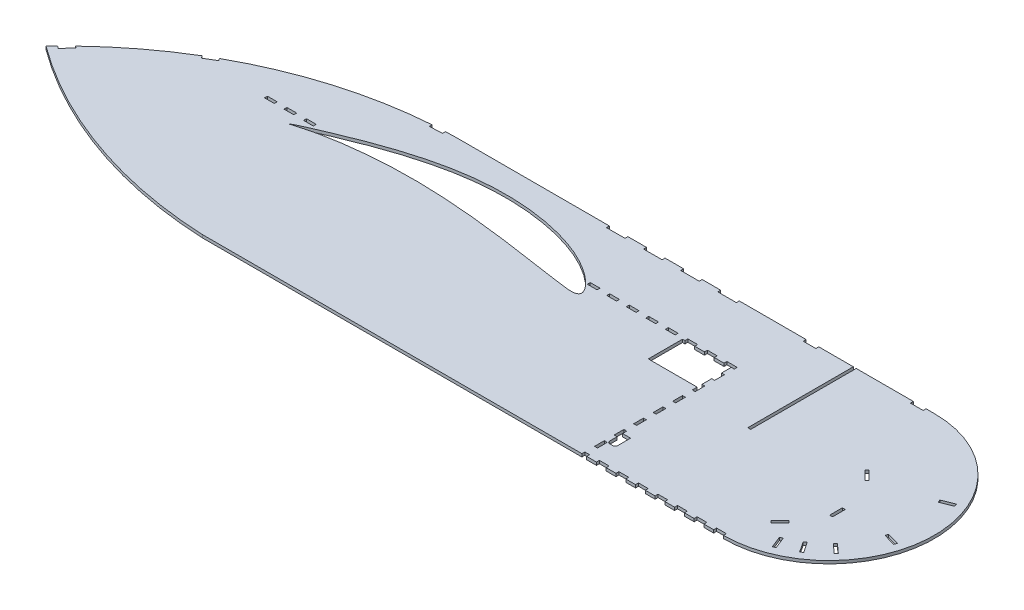
from build123d import *

# Parameters (mm, degrees)
BOSS_EXTRUDE1_DEPTH = 3
SKETCH2_W           = 3
SKETCH2_H           = 13
SKETCH2_W_2         = 13
SKETCH2_H_2         = 3
SKETCH2_W_3         = 19
SKETCH2_W_4         = 10
SKETCH2_H_3         = 10
SKETCH2_W_5         = 4.93
SKETCH2_H_4         = 108
CUT_EXTRUDE1_DEPTH  = 934.342916617


with BuildPart() as part:
    # Sketch1 → Boss-Extrude1 (new body)
    with BuildSketch(Plane(origin=(0, 0, 0), x_dir=(1, 0, 0), z_dir=(0, 1, 0))):
        with BuildLine():
            Line((266.408252791, 0), (800, 0))
            ThreePointArc((800, 0), (908, 108), (800, 216))
            Line((800, 216), (316.294556964, 216))
            ThreePointArc((316.294556964, 216), (154.432198565, 182.326352039), (19.429068043, 86.893169221))
            ThreePointArc((19.429068043, 86.893169221), (136.475600537, 25.133273094), (266.408252791, 0))
        make_face()
    extrude(amount=BOSS_EXTRUDE1_DEPTH)

    # Sketch2 → Cut-Extrude1 (cut, through all)
    with BuildSketch(Plane.XZ):
        Polygon((647.57, -153), (637.57, -153), (637.57, -156), (627.57, -156), (627.57, -153), (617.57, -153), (617.57, -156), (607.57, -156), (607.57, -153), (605.07, -153), (605.07, -118), (655.07, -118), (655.07, -113), (658.07, -113), (658.07, -123), (655.07, -123), (655.07, -133), (658.07, -133), (658.07, -143), (655.07, -143), (655.07, -153), (658.07, -153), (658.07, -156), (647.57, -156), align=None)
        Polygon((823.689305433, -121.232773417), (814.496917278, -130.425161573), (816.618237622, -132.546481916), (825.810625777, -123.354093761), align=None)
        Polygon((833.160643349, -28.105884629), (837.93522035, -16.014424235), (835.144883336, -14.912598773), (830.370306335, -27.004059167), align=None)
        with Locations((837.95655194, -78.816857664)):
            Rectangle(SKETCH2_W, SKETCH2_H)
        with BuildLine():
            Line((658.07, -25.473381029), (658.07, -33))
            Line((658.07, -33), (655.07, -33))
            Line((655.07, -33), (655.07, -43))
            Line((655.07, -43), (658.07, -43))
            Line((658.07, -43), (658.07, -38.673381029))
            Line((658.07, -38.673381029), (666.27, -38.673381029))
            Line((666.27, -38.673381029), (666.27, -25.473381029))
            ThreePointArc((666.27, -25.473381029), (665.537766953, -23.705614076), (663.77, -22.973381029))
            Line((663.77, -22.973381029), (660.57, -22.973381029))
            ThreePointArc((660.57, -22.973381029), (658.802233047, -23.705614076), (658.07, -25.473381029))
        make_face()
        with BuildLine():
            Line((212.57, -142.261782597), (212.57, -142.294782597))
            add(Edge.make_bspline(
                [(212.57, -142.294782597), (212.815137814, -142.460102486), (213.721483955, -143.071338431), (215.664179604, -144.220627165), (218.723437449, -145.777902142), (222.783765044, -147.580430449), (227.75908382, -149.780753256), (233.673151887, -152.372942719), (243.334631626, -156.473964415), (254.071597155, -160.928560196), (265.811315632, -165.551386352), (275.559769605, -169.192616013), (285.820264156, -172.789650289), (300.213165162, -177.442893994), (315.047470761, -181.61442891), (330.216772764, -185.078244178), (341.716798025, -187.262793988), (353.238408154, -188.970546018), (364.74982071, -190.189827969), (376.222154657, -190.889317525), (387.611451467, -191.086885836), (398.853751386, -190.764655348), (413.421420996, -189.696341642), (427.580802498, -187.700042396), (441.195366572, -184.827458978), (450.821943115, -182.319735681), (459.948918056, -179.469695278), (468.511745548, -176.287644359), (476.453624938, -172.824739179), (483.715148146, -169.128859345), (490.24814377, -165.284833696), (496.019667562, -161.40694583), (500.998027396, -157.585747413), (505.147593549, -153.884087589), (508.447339472, -150.382728864), (510.852240131, -147.180842115), (512.23052565, -144.518995071), (512.672376723, -142.438033672), (512.365957104, -140.693980261), (510.836297954, -139.267947677), (508.300825673, -138.604557497), (504.990749494, -138.396901122), (500.845143819, -138.632879923), (495.886387834, -139.207005807), (490.127383335, -140.033765729), (483.600688534, -141.01415409), (476.345974836, -142.081971784), (468.41886468, -143.270863791), (459.86962452, -144.552957933), (447.40415706, -146.414008038), (434.302787697, -148.29198326), (413.230560269, -151.080307043), (394.916461571, -153.170522792), (372.413070638, -155.185169178), (353.278576878, -156.497400442), (334.10390548, -157.12050793), (318.83753012, -157.119300437), (307.569298967, -156.863067348), (296.54483902, -156.342386113), (285.853643217, -155.59861473), (275.586288909, -154.654588864), (265.829573747, -153.556930461), (256.673464041, -152.312824912), (248.205041684, -150.95854436), (240.510067524, -149.523302558), (233.666056009, -148.064077742), (227.735558734, -146.629571507), (222.771530443, -145.20558608), (218.774640723, -143.912633605), (215.724793866, -142.995242016), (213.753356987, -142.496728121), (212.816237246, -142.310670921), (212.57, -142.261782597)],
                knots=[0, 0, 0, 0, 0.001413477, 0.005226038, 0.010781091, 0.017815608, 0.026460951, 0.036790889, 0.048685593, 0.076639155, 0.092362872, 0.109003461, 0.126386903, 0.144339126, 0.181312719, 0.200023431, 0.218712626, 0.237261299, 0.255692478, 0.274037197, 0.292192583, 0.310132767, 0.327788163, 0.362001934, 0.378421226, 0.394286639, 0.40954344, 0.424114253, 0.43793778, 0.450941833, 0.463044023, 0.474154417, 0.484164575, 0.493023962, 0.500713088, 0.507125739, 0.512129705, 0.514904185, 0.517171427, 0.520261618, 0.5242453, 0.529497961, 0.536092185, 0.54406114, 0.553363127, 0.563904543, 0.575614949, 0.588420092, 0.60222661, 0.616944448, 0.648675826, 0.665501113, 0.718564132, 0.736789145, 0.773513212, 0.810244924, 0.828488569, 0.846493195, 0.864125178, 0.88124851, 0.897725282, 0.913415058, 0.928184346, 0.941897285, 0.954411455, 0.965602702, 0.975349728, 0.983575522, 0.990284579, 0.99543259, 0.998799869, 1, 1, 1, 1], degree=3))
        make_face()
        Polygon((879.488683309, -142.12106628), (891.521725576, -147.041014837), (892.65709832, -144.264158929), (880.624056053, -139.344210372), align=None)
        Polygon((883.5475205, -85.58327061), (896.043113277, -81.997163924), (895.215550195, -79.113565591), (882.719957419, -82.699672277), align=None)
        Polygon((865.360730479, -51.33720048), (875.034295558, -42.652608454), (873.030158937, -40.420247281), (863.356593858, -49.104839307), align=None)
        Polygon((849.064781802, -36.758543495), (856.251694152, -25.925801881), (853.751830703, -24.267283646), (846.564918353, -35.10002526), align=None)
        Polygon((822.408918344, -44.734564455), (813.216530188, -35.542176299), (811.095209845, -37.663496643), (820.287598, -46.855884798), align=None)
        with Locations((785, -214.5)):
            Rectangle(SKETCH2_W_2, SKETCH2_H_2)
        with Locations((675.107627624, -214.5)):
            Rectangle(SKETCH2_W_2, SKETCH2_H_2)
        with Locations((590.701810534, -214.5)):
            Rectangle(SKETCH2_W_3, SKETCH2_H_2)
        with Locations((552.701810534, -214.5)):
            Rectangle(SKETCH2_W_3, SKETCH2_H_2)
        with Locations((514.701810534, -214.5)):
            Rectangle(SKETCH2_W_3, SKETCH2_H_2)
        with Locations((476.701810534, -214.5)):
            Rectangle(SKETCH2_W_3, SKETCH2_H_2)
        Polygon((286.653605669, -215.067910052), (299.639993398, -215.662665262), (299.777244601, -212.665806556), (286.790856872, -212.071051345), align=None)
        Polygon((107.891846949, -158.40758228), (119.051202256, -165.076074548), (120.590085087, -162.500838708), (109.43072978, -155.83234644), align=None)
        Polygon((25.225136805, -93.110530953), (34.089712558, -102.619437132), (36.284075522, -100.573765804), (27.419499769, -91.064859625), align=None)
        with Locations((532.57, -154.5)):
            Rectangle(SKETCH2_W_4, SKETCH2_H_2)
        with Locations((552.57, -154.5)):
            Rectangle(SKETCH2_W_4, SKETCH2_H_2)
        with Locations((572.57, -154.5)):
            Rectangle(SKETCH2_W_4, SKETCH2_H_2)
        with Locations((592.57, -154.5)):
            Rectangle(SKETCH2_W_4, SKETCH2_H_2)
        with Locations((656.57, -98)):
            Rectangle(SKETCH2_W, SKETCH2_H_3)
        with Locations((656.57, -78)):
            Rectangle(SKETCH2_W, SKETCH2_H_3)
        with Locations((656.57, -58)):
            Rectangle(SKETCH2_W, SKETCH2_H_3)
        with Locations((656.57, -18)):
            Rectangle(SKETCH2_W, SKETCH2_H_3)
        with Locations((657.535, -1.5)):
            Rectangle(SKETCH2_W_5, SKETCH2_H_2)
        with Locations((675, -1.5)):
            Rectangle(SKETCH2_W_4, SKETCH2_H_2)
        with Locations((695, -1.5)):
            Rectangle(SKETCH2_W_4, SKETCH2_H_2)
        with Locations((715, -1.5)):
            Rectangle(SKETCH2_W_4, SKETCH2_H_2)
        with Locations((735, -1.5)):
            Rectangle(SKETCH2_W_4, SKETCH2_H_2)
        with Locations((755, -1.5)):
            Rectangle(SKETCH2_W_4, SKETCH2_H_2)
        with Locations((775, -1.5)):
            Rectangle(SKETCH2_W_4, SKETCH2_H_2)
        with Locations((795, -1.5)):
            Rectangle(SKETCH2_W_4, SKETCH2_H_2)
        with Locations((182.07, -154.5)):
            Rectangle(SKETCH2_W_4, SKETCH2_H_2)
        with Locations((202.07, -154.5)):
            Rectangle(SKETCH2_W_4, SKETCH2_H_2)
        with Locations((222.07, -154.5)):
            Rectangle(SKETCH2_W_4, SKETCH2_H_2)
        with Locations((512.57, -154.5)):
            Rectangle(SKETCH2_W_4, SKETCH2_H_2)
        with Locations((718.5, -162)):
            Rectangle(SKETCH2_W, SKETCH2_H_4)
    extrude(amount=-CUT_EXTRUDE1_DEPTH, mode=Mode.SUBTRACT)


solid = part.part
